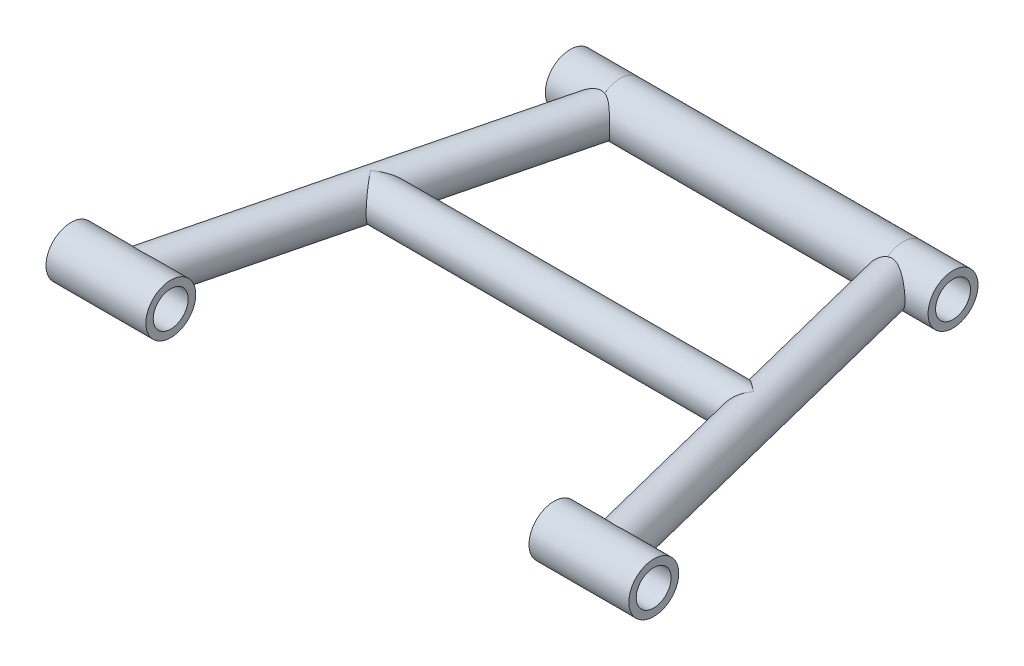
from build123d import *

# Parameters (mm, degrees)
SWEEP1_PROFILE_R        = 20
SWEEP2_START            = -74.696203031
SWEEP2_OUTLINE_R        = 20
SWEEP2_DEPTH            = 412.392012033
SWEEP3_PROFILE_R        = 20
SWEEP4_PROFILE_R        = 25
SWEEP5_PROFILE_R        = 25
SWEEP6_START            = -273.956371512
SWEEP6_OUTLINE_R        = 25
SWEEP6_DEPTH            = 283.359378358
SWEEP7_PROFILE_R        = 25
SWEEP8_PROFILE_R        = 25
CUT_EXTRUDE1_DEPTH      = 10
CUT_EXTRUDE1_DEPTH_BACK = 583.694674
SKETCH110_R             = 17.5
SKETCH127_R             = 17.5
CUT_EXTRUDE2_DEPTH      = 510


# Read off the part's stored shape, not the designer's step: Sweep2, Sweep6
with BuildPart() as part:
    # Sweep1: sweep along a path in Lower wishbone
    with BuildLine(Plane(origin=(0, 0, 0), x_dir=(1, 0, 0), z_dir=(0, 1, 0))) as sweep1_path:
        Line((-373.956371512, -320.631072668), (-273.956371512, 79.368927332))
    # Sweep1 profile (on start of the path) → Sweep1 (sweep)
    with BuildSketch(Plane(origin=(-373.956371512, 0, 320.631072668), x_dir=(-0.9701425001453319, 0, -0.2425356250363329), z_dir=(0.2425356250363329, 0, -0.9701425001453319))):
        Circle(SWEEP1_PROFILE_R)
    sweep(path=sweep1_path.line)



with BuildPart() as body_2:
    # Sweep2 outline → Sweep2 (new body)
    with BuildSketch(Plane(origin=(0, 0, 0), x_dir=(0.9699508921808406, 0, -0.24330077426426597), z_dir=(0.24330077426426594, 0, 0.9699508921808407)).offset(SWEEP2_START)):
        with Locations((28.430976352, 0)):
            Circle(SWEEP2_OUTLINE_R)
    extrude(amount=SWEEP2_DEPTH)


with BuildPart() as part_1:
    add(part.part)

    add(body_2.part)  # Sweep3 merges body 2
    # Sweep3: sweep along a path in Lower wishbone<7>
    with BuildLine(Plane(origin=(0, 0, 0), x_dir=(1, 0, 0), z_dir=(0, 1, 0))) as sweep3_path:
        Line((-323.956371512, -120.631072668), (59.57065476, -120.631072668))
    # Sweep3 profile (on start of the path) → Sweep3 (sweep)
    with BuildSketch(Plane(origin=(-323.956371512, 0, 120.631072668), x_dir=(0, 0, 1), z_dir=(1, 0, 0))):
        Circle(SWEEP3_PROFILE_R)
    sweep(path=sweep3_path.line)


with BuildPart() as body_2_2:
    # Sweep4: sweep along a path in Lower wishbone<8>
    with BuildLine(Plane(origin=(0, 0, 0), x_dir=(1, 0, 0), z_dir=(0, 1, 0))) as sweep4_path:
        Line((59.738302674, -320.631072668), (159.738302674, -320.631072668))
    # Sweep4 profile (on start of the path) → Sweep4 (sweep)
    with BuildSketch(Plane(origin=(59.738302674, 0, 320.631072668), x_dir=(0, 0, 1), z_dir=(1, 0, 0))):
        Circle(SWEEP4_PROFILE_R)
    sweep(path=sweep4_path.line)


with BuildPart() as body_3:
    # Sweep5: sweep along a path in Lower wishbone<9>
    with BuildLine(Plane(origin=(0, 0, 0), x_dir=(1, 0, 0), z_dir=(0, 1, 0))) as sweep5_path:
        Line((-323.956371512, -320.631072668), (-423.956371512, -320.631072668))
    # Sweep5 profile (on start of the path) → Sweep5 (sweep)
    with BuildSketch(Plane(origin=(-323.956371512, 0, 320.631072668), x_dir=(0, 0, -1), z_dir=(-1, 0, 0))):
        Circle(SWEEP5_PROFILE_R)
    sweep(path=sweep5_path.line)


with BuildPart() as body_4:
    # Sweep6 outline → Sweep6 (new body)
    with BuildSketch(Plane.YZ.offset(SWEEP6_START)):
        with Locations((0, -79.368927332)):
            Circle(SWEEP6_OUTLINE_R)
    extrude(amount=SWEEP6_DEPTH)


with BuildPart() as body_5:
    # Sweep7: sweep along a path in Lower wishbone<11>
    with BuildLine(Plane(origin=(0, 0, 0), x_dir=(1, 0, 0), z_dir=(0, 1, 0))) as sweep7_path:
        Line((-273.956371512, 79.368927332), (-323.956371512, 79.368927332))
    # Sweep7 profile (on start of the path) → Sweep7 (sweep)
    with BuildSketch(Plane(origin=(-273.956371512, 0, -79.368927332), x_dir=(0, 0, -1), z_dir=(-1, 0, 0))):
        Circle(SWEEP7_PROFILE_R)
    sweep(path=sweep7_path.line)


with BuildPart() as body_6:
    # Sweep8: sweep along a path in Lower wishbone<12>
    with BuildLine(Plane(origin=(0, 0, 0), x_dir=(1, 0, 0), z_dir=(0, 1, 0))) as sweep8_path:
        Line((9.403006846, 79.368927332), (59.403006846, 79.368927332))
    # Sweep8 profile (on start of the path) → Sweep8 (sweep)
    with BuildSketch(Plane(origin=(9.403006846, 0, -79.368927332), x_dir=(0, 0, 1), z_dir=(1, 0, 0))):
        Circle(SWEEP8_PROFILE_R)
    sweep(path=sweep8_path.line)


with BuildPart() as cut_extrude1_tool:
    # Sketch110 → Cut-Extrude1 (new, two sides: drawn at the far end of the back side and taken through both)
    with BuildSketch(Plane.ZY.offset(423.956371512).offset(-CUT_EXTRUDE1_DEPTH_BACK)):
        with Locations((320.745233447, 0)):
            Circle(SKETCH110_R)
    extrude(amount=CUT_EXTRUDE1_DEPTH + CUT_EXTRUDE1_DEPTH_BACK)


with BuildPart() as part_2:
    add(part_1.part)

    # Cut-Extrude1: cut by cut_extrude1_tool
    add(cut_extrude1_tool.part, mode=Mode.SUBTRACT)


with BuildPart() as body_2_2_1:
    add(body_2_2.part)

    # Cut-Extrude1: cut by cut_extrude1_tool
    add(cut_extrude1_tool.part, mode=Mode.SUBTRACT)


with BuildPart() as body_3_1:
    add(body_3.part)

    # Cut-Extrude1: cut by cut_extrude1_tool
    add(cut_extrude1_tool.part, mode=Mode.SUBTRACT)


with BuildPart() as cut_extrude2_tool:
    # Sketch127 → Cut-Extrude2 (new body)
    with BuildSketch(Plane.ZY.offset(323.956371512)):
        with Locations(Location((-79.367471676, 0, 0), (0, 0, 180))):
            Circle(SKETCH127_R)
    extrude(amount=-CUT_EXTRUDE2_DEPTH)


with BuildPart() as part_3:
    add(part_2.part)

    # Cut-Extrude2: cut by cut_extrude2_tool
    add(cut_extrude2_tool.part, mode=Mode.SUBTRACT)


with BuildPart() as body_4_1:
    add(body_4.part)

    # Cut-Extrude2: cut by cut_extrude2_tool
    add(cut_extrude2_tool.part, mode=Mode.SUBTRACT)


with BuildPart() as body_5_1:
    add(body_5.part)

    # Cut-Extrude2: cut by cut_extrude2_tool
    add(cut_extrude2_tool.part, mode=Mode.SUBTRACT)


with BuildPart() as body_6_1:
    add(body_6.part)

    # Cut-Extrude2: cut by cut_extrude2_tool
    add(cut_extrude2_tool.part, mode=Mode.SUBTRACT)


solid = Compound([body_2_2_1.part, body_3_1.part, part_3.part, body_4_1.part, body_5_1.part, body_6_1.part])
